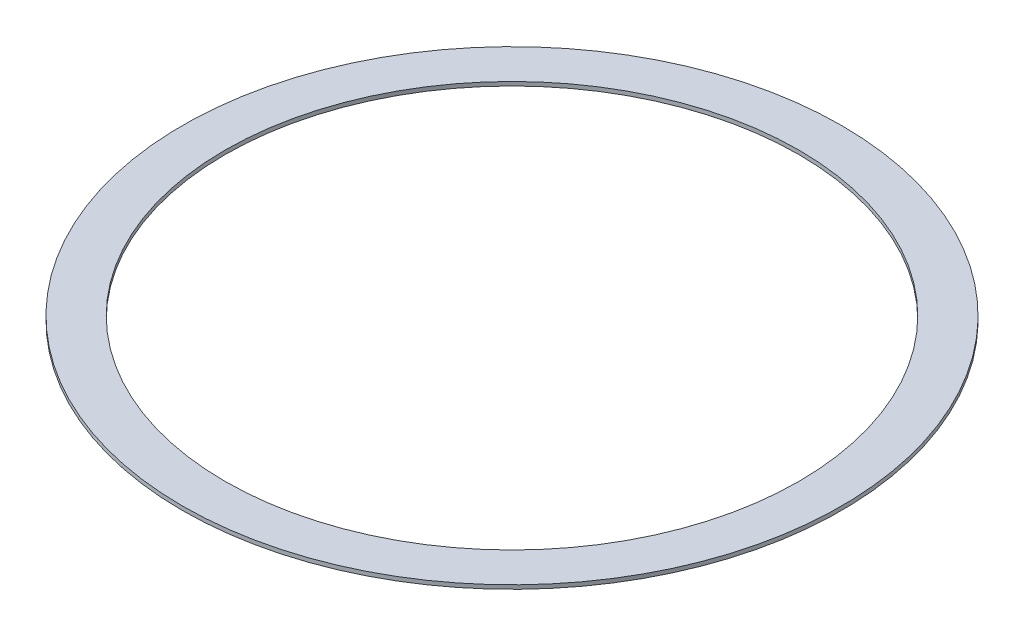
from build123d import *

# Parameters (mm, degrees)
SKETCH1_R           = 63.8175
SKETCH1_R_2         = 55.5625
BOSS_EXTRUDE2_DEPTH = 0.762


with BuildPart() as part:
    # Sketch1 → Boss-Extrude2 (new body)
    with BuildSketch(Plane(origin=(0, 0, 0), x_dir=(1, 0, 0), z_dir=(0, 1, 0))):
        Circle(SKETCH1_R)
        Circle(SKETCH1_R_2, mode=Mode.SUBTRACT)
    extrude(amount=BOSS_EXTRUDE2_DEPTH)


solid = part.part
